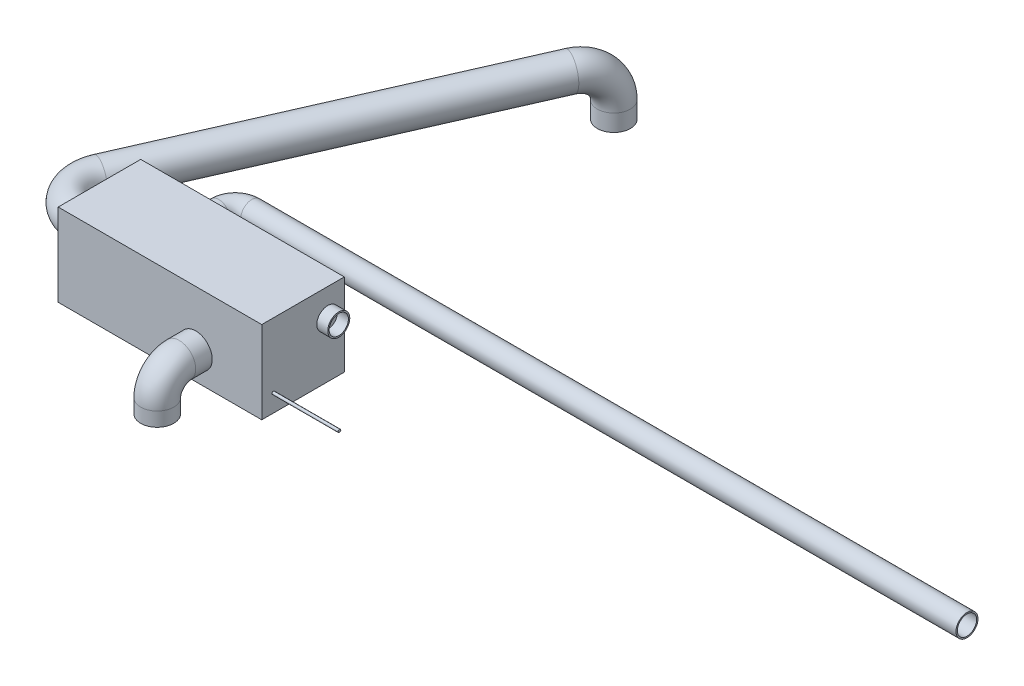
from build123d import *

# Parameters (mm, degrees)
SKETCH1_W           = 939.8
SKETCH1_H           = 381
BOSS_EXTRUDE1_DEPTH = 381
SKETCH2_R           = 76.2
SKETCH2_R_2         = 69.85
BOSS_EXTRUDE2_DEPTH = 50.8
SKETCH3_R           = 50.8
SKETCH3_R_2         = 44.45
BOSS_EXTRUDE3_DEPTH = 50.8
SKETCH4_R           = 6.35
BOSS_EXTRUDE4_DEPTH = 304.8
SKETCH5_R           = 50.8
SKETCH5_R_2         = 44.45
BOSS_EXTRUDE5_DEPTH = 50.8
SKETCH6_R           = 76.2
SKETCH6_R_2         = 69.85
BOSS_EXTRUDE6_DEPTH = 50.8
SKETCH7_R           = 76.2
SKETCH7_R_2         = 69.85
SKETCH10_R          = 76.2
SKETCH10_R_2        = 69.85
SKETCH11_R          = 76.2
SKETCH11_R_2        = 69.85
SKETCH14_R          = 50.8
SKETCH14_R_2        = 44.45


with BuildPart() as part:
    # Sketch1 → Boss-Extrude1 (new body)
    with BuildSketch(Plane(origin=(0, 0, 0), x_dir=(1, 0, 0), z_dir=(0, 1, 0))):
        Rectangle(SKETCH1_W, SKETCH1_H)
    extrude(amount=BOSS_EXTRUDE1_DEPTH)

    # Sketch2 → Boss-Extrude2 (add)
    with BuildSketch(Plane.XY.offset(190.5)):
        with Locations((165.1, 127)):
            Circle(SKETCH2_R)
        with Locations((165.1, 127)):
            Circle(SKETCH2_R_2, mode=Mode.SUBTRACT)
    extrude(amount=BOSS_EXTRUDE2_DEPTH)

    # Sketch3 → Boss-Extrude3 (add)
    with BuildSketch(Plane(origin=(469.9, 0, 0), x_dir=(0, 0, -1), z_dir=(1, 0, 0))):
        with Locations((114.3, 254)):
            Circle(SKETCH3_R)
        with Locations((114.3, 254)):
            Circle(SKETCH3_R_2, mode=Mode.SUBTRACT)
    extrude(amount=BOSS_EXTRUDE3_DEPTH)

    # Sketch4 → Boss-Extrude4 (add)
    with BuildSketch(Plane(origin=(469.9, 0, 0), x_dir=(0, 0, -1), z_dir=(1, 0, 0))):
        with Locations((-136.850125002, 81.35113945)):
            Circle(SKETCH4_R)
    extrude(amount=BOSS_EXTRUDE4_DEPTH)

    # Sketch5 → Boss-Extrude5 (add)
    with BuildSketch(Plane(origin=(0, 0, -190.5), x_dir=(-1, 0, 0), z_dir=(0, 0, -1))):
        with Locations((185.69264526, 273.888159849)):
            Circle(SKETCH5_R)
        with Locations((185.69264526, 273.888159849)):
            Circle(SKETCH5_R_2, mode=Mode.SUBTRACT)
    extrude(amount=BOSS_EXTRUDE5_DEPTH)

    # Sketch6 → Boss-Extrude6 (add)
    with BuildSketch(Plane.ZY.offset(469.9)):
        with Locations((0, 190.5)):
            Circle(SKETCH6_R)
        with Locations((0, 190.5)):
            Circle(SKETCH6_R_2, mode=Mode.SUBTRACT)
    extrude(amount=BOSS_EXTRUDE6_DEPTH)

    # Sweep1: sweep along a path in Sketch8
    with BuildLine(Plane(origin=(165.1, 0, 0), x_dir=(0, 0, -1), z_dir=(1, 0, 0))) as sweep1_path:
        Line((-241.3, 127), (-266.7, 127))
        ThreePointArc((-266.7, 127), (-338.542048969, 97.242048969), (-368.3, 25.4))
        Line((-368.3, 25.4), (-368.3, -39.617444979))
    # Sketch7 → Sweep1 (sweep)
    with BuildSketch(Plane.XY.offset(241.3)):
        with Locations((165.1, 127)):
            Circle(SKETCH7_R)
        with Locations((165.1, 127)):
            Circle(SKETCH7_R_2, mode=Mode.SUBTRACT)
    sweep(path=sweep1_path.line)

    # Sweep2: sweep along a path in Sketch9
    with BuildLine(Plane(origin=(0, 190.5, 0), x_dir=(1, 0, 0), z_dir=(0, 1, 0))) as sweep2_path:
        Line((-520.7, 0), (-546.1, 0))
        ThreePointArc((-546.1, 0), (-673.724643594, 69.107081049), (-685.604318833, 213.753932449))
        Line((-685.604318833, 213.753932449), (-31.162372709, 1701.8))
    # Sketch10 → Sweep2 (sweep)
    with BuildSketch(Plane.ZY.offset(520.7)):
        with Locations((0, 190.5)):
            Circle(SKETCH10_R)
        with Locations((0, 190.5)):
            Circle(SKETCH10_R_2, mode=Mode.SUBTRACT)
    sweep(path=sweep2_path.line)

    # Sweep4: sweep along a path in Sketch12
    with BuildLine(Plane(origin=(-318.464805895, 0, -1048.542276482), x_dir=(0.4025848585899447, 0, -0.9153826695071927), z_dir=(0.9153826695071927, 0, 0.4025848585899447))) as sweep4_path:
        Line((891.444408267, -39.617444979), (891.444408267, 38.1))
        ThreePointArc((891.444408267, 38.1), (846.80748172, 145.863073453), (739.044408267, 190.5))
        Line((739.044408267, 190.5), (713.644408267, 190.5))
    # Sketch11 → Sweep4 (sweep)
    with BuildSketch(Plane(origin=(622.095350809, 0, -1414.497566814), x_dir=(-0.9153826695071914, 0, -0.4025848585899478), z_dir=(0.40258485858994775, 0, -0.9153826695071913))):
        with Locations((713.644408267, 190.5)):
            Circle(SKETCH11_R)
        with Locations((713.644408267, 190.5)):
            Circle(SKETCH11_R_2, mode=Mode.SUBTRACT)
    sweep(path=sweep4_path.line)

    # Sweep5: sweep along a path in Sketch13
    with BuildLine(Plane(origin=(0, 273.888159849, 0), x_dir=(1, 0, 0), z_dir=(0, 1, 0))) as sweep5_path:
        Line((-185.69264526, 241.3), (-185.69264526, 266.7))
        ThreePointArc((-185.69264526, 266.7), (-163.374181986, 320.581536726), (-109.49264526, 342.9))
        Line((-109.49264526, 342.9), (3192.50735474, 342.9))
    # Sketch14 → Sweep5 (sweep)
    with BuildSketch(Plane(origin=(0, 0, -241.3), x_dir=(-1, 0, 0), z_dir=(0, 0, -1))):
        with Locations((185.69264526, 273.888159849)):
            Circle(SKETCH14_R)
        with Locations((185.69264526, 273.888159849)):
            Circle(SKETCH14_R_2, mode=Mode.SUBTRACT)
    sweep(path=sweep5_path.line)


solid = part.part
